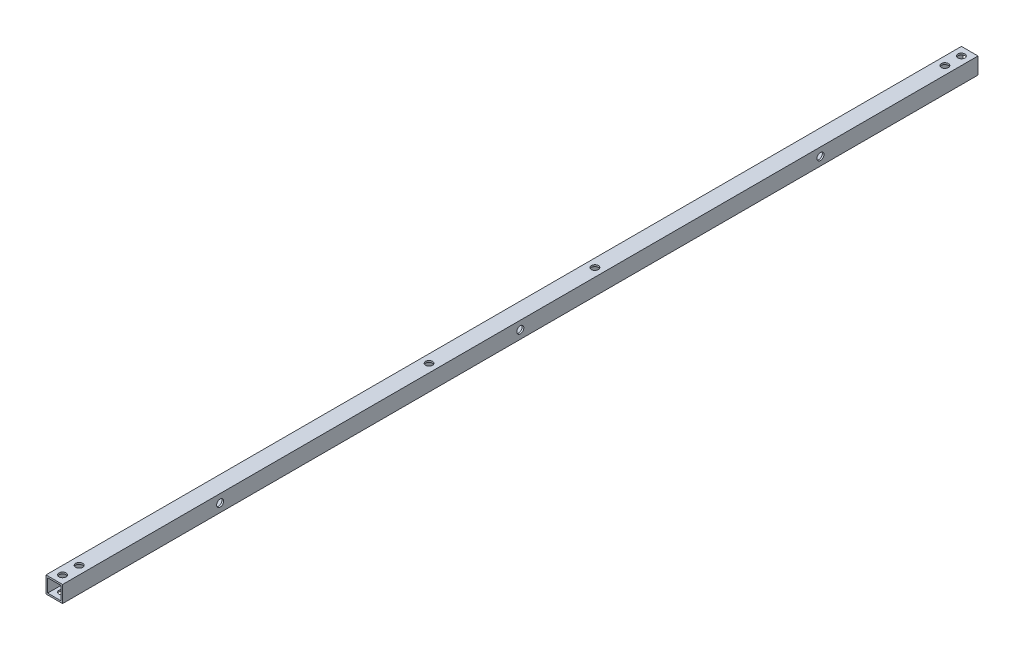
from build123d import *

# Parameters (mm, degrees)
SKETCH1_W           = 10
SKETCH1_H           = 10
SKETCH1_W_2         = 8
SKETCH1_H_2         = 8
BOSS_EXTRUDE1_DEPTH = 552
SKETCH2_R           = 2.125
CUT_EXTRUDE1_DEPTH  = 116
SKETCH3_R           = 2.1
SKETCH3_R_2         = 2.125
CUT_EXTRUDE2_DEPTH  = 10
SKETCH5_R           = 2.125
CUT_EXTRUDE3_DEPTH  = 10


with BuildPart() as part:
    # Sketch1 → Boss-Extrude1 (new body)
    with BuildSketch(Plane.XY):
        with Locations((5, 5)):
            Rectangle(SKETCH1_W, SKETCH1_H)
        with Locations((5, 5)):
            Rectangle(SKETCH1_W_2, SKETCH1_H_2, mode=Mode.SUBTRACT)
    extrude(amount=BOSS_EXTRUDE1_DEPTH)

    # Sketch2 → Cut-Extrude1 (cut)
    with BuildSketch(Plane(origin=(0, 10, 0), x_dir=(1, 0, 0), z_dir=(0, 1, 0))):
        with Locations((5, -5)):
            Circle(SKETCH2_R)
        with Locations((5, -15)):
            Circle(SKETCH2_R)
        with Locations((5, -537)):
            Circle(SKETCH2_R)
        with Locations((5, -547)):
            Circle(SKETCH2_R)
    extrude(amount=-CUT_EXTRUDE1_DEPTH, mode=Mode.SUBTRACT)

    # Sketch3 → Cut-Extrude2 (cut)
    with BuildSketch(Plane.XZ):
        with Locations((5, 326)):
            Circle(SKETCH3_R)
        with Locations((5, 226)):
            Circle(SKETCH3_R_2)
    extrude(amount=-CUT_EXTRUDE2_DEPTH, mode=Mode.SUBTRACT)

    # Sketch5 → Cut-Extrude3 (cut)
    with BuildSketch(Plane(origin=(10, 0, 0), x_dir=(0, 0, -1), z_dir=(1, 0, 0))):
        with Locations((-457, 5)):
            Circle(SKETCH5_R)
        with Locations((-95, 5)):
            Circle(SKETCH5_R)
        with Locations((-276, 5)):
            Circle(SKETCH5_R)
    extrude(amount=-CUT_EXTRUDE3_DEPTH, mode=Mode.SUBTRACT)


solid = part.part
